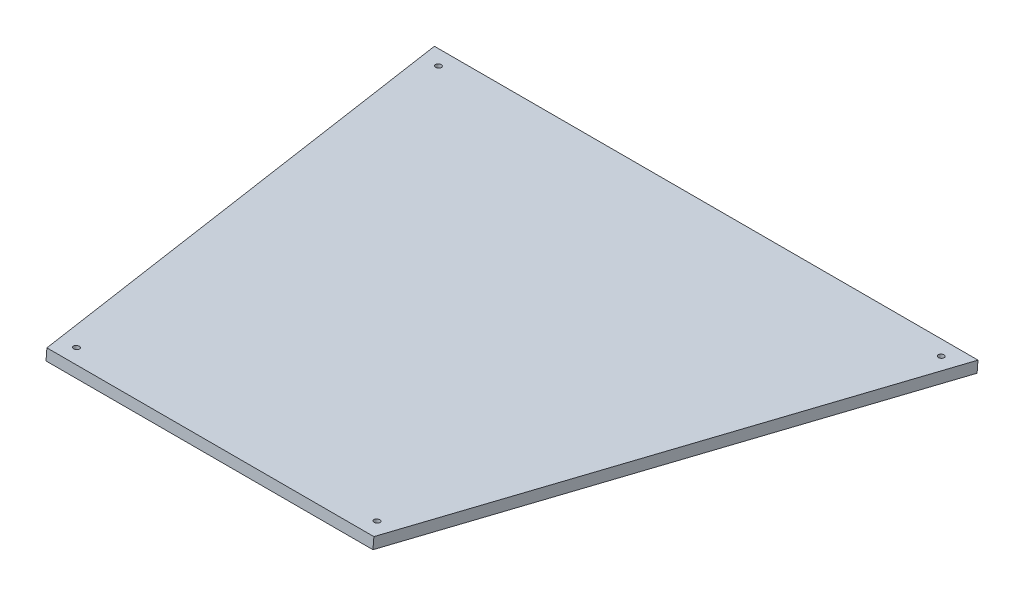
from build123d import *

# Parameters (mm, degrees)
BOSS_EXTRUDE1_DEPTH = 12.7
SKETCH2_R           = 3.2639
CUT_EXTRUDE1_DEPTH  = 2375.892579805


with BuildPart() as part:
    # Sketch1 → Boss-Extrude1 (new body)
    with BuildSketch(Plane(origin=(-0.000988386, -12330.884848342, 1017.217455053), x_dir=(-0.9999999999999969, 7.961414168714261e-08, -6.567661367452003e-09), z_dir=(-7.988457756299226e-08, -0.9966146823530267, 0.08221420143971164))):
        Polygon((927.932358994, -1893.288402131), (1306.839320113, -1893.288402131), (1432.352062842, -1316.739819062), (802.419616266, -1316.739819062), align=None)
    extrude(amount=BOSS_EXTRUDE1_DEPTH)

    # Sketch2 → Cut-Extrude1 (cut, through all)
    with BuildSketch(Plane(origin=(-0.000988394, -12330.884848342, 1017.217455053), x_dir=(0.9999999999999968, -7.961414422751635e-08, 6.5676468617910225e-09), z_dir=(7.988457890219469e-08, 0.9966146823530273, -0.08221420143970454))):
        with Locations((-1291.490301396, -1874.248960327)):
            Circle(SKETCH2_R)
        with Locations((-943.281377695, -1874.248960327)):
            Circle(SKETCH2_R)
        with Locations((-826.062950676, -1335.800699708)):
            Circle(SKETCH2_R)
        with Locations((-1408.708728416, -1335.800699708)):
            Circle(SKETCH2_R)
    extrude(amount=-CUT_EXTRUDE1_DEPTH, mode=Mode.SUBTRACT)


solid = part.part
